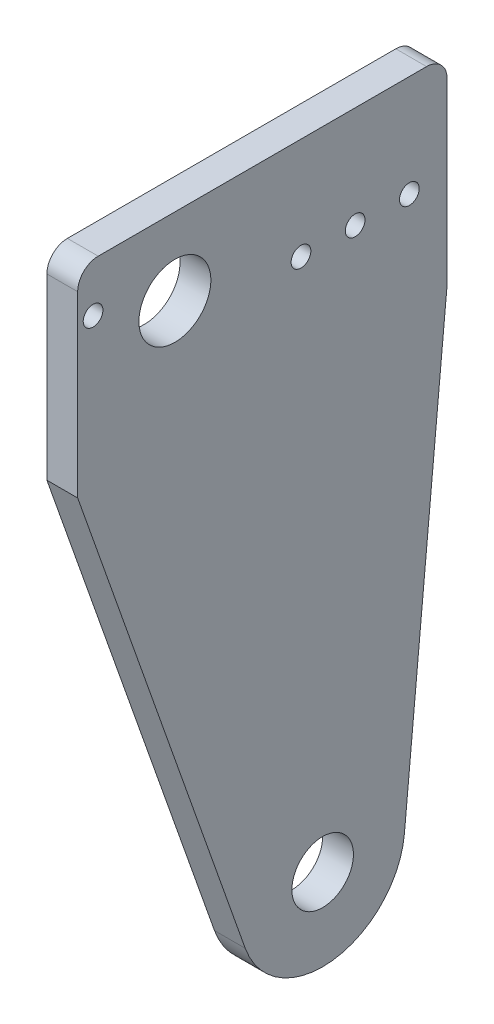
from build123d import *

# Parameters (mm, degrees)
SKETCH1_R           = 4.7625
SKETCH1_R_2         = 5.5626
SKETCH1_R_3         = 1.524
BOSS_EXTRUDE1_DEPTH = 4.7625


with BuildPart() as part:
    # Sketch1 → Boss-Extrude1 (new body)
    with BuildSketch(Plane(origin=(0, 0, 0), x_dir=(0, 0, -1), z_dir=(1, 0, 0))):
        with BuildLine():
            Line((42.1132, 8.7376), (42.1132, -18.894289209))
            Line((42.1132, -18.894289209), (35.505898787, -89.148965396))
            ThreePointArc((35.505898787, -89.148965396), (24.421013785, -100.56371426), (10.888521103, -92.194556062))
            Line((10.888521103, -92.194556062), (-15.0368, -18.894289209))
            Line((-15.0368, -18.894289209), (-15.0368, 8.7376))
            ThreePointArc((-15.0368, 8.7376), (-14.10686403, 10.98266403), (-11.8618, 11.9126))
            Line((-11.8618, 11.9126), (38.9382, 11.9126))
            ThreePointArc((38.9382, 11.9126), (41.18326403, 10.98266403), (42.1132, 8.7376))
        make_face()
        with Locations((22.86169466, -87.959805189)):
            Circle(SKETCH1_R, mode=Mode.SUBTRACT)
        Circle(SKETCH1_R_2, mode=Mode.SUBTRACT)
        with Locations((-12.65555, 4.3307)):
            Circle(SKETCH1_R_3, mode=Mode.SUBTRACT)
        with Locations((36.2712, -3.8354)):
            Circle(SKETCH1_R_3, mode=Mode.SUBTRACT)
        with Locations((27.8892, -3.8354)):
            Circle(SKETCH1_R_3, mode=Mode.SUBTRACT)
        with Locations((19.5072, -3.8354)):
            Circle(SKETCH1_R_3, mode=Mode.SUBTRACT)
    extrude(amount=BOSS_EXTRUDE1_DEPTH)


solid = part.part
